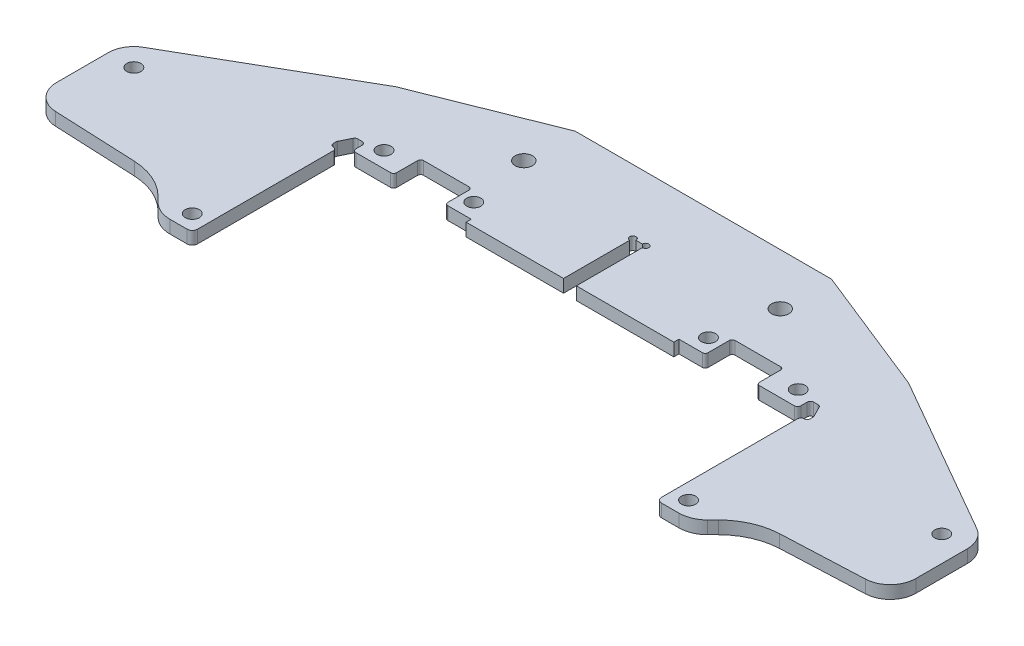
from build123d import *

# Parameters (mm, degrees)
EXTRUDE_1_DEPTH      = 2
CUT_EXTRUDE_1_DEPTH  = 10
SKETCH_3_W           = 2
SKETCH_3_H           = 10
CUT_EXTRUDE_2_DEPTH  = 10
CUT_EXTRUDE_3_DEPTH  = 10
SKETCH_5_W           = 23
SKETCH_5_H           = 22.484633815
CUT_EXTRUDE_4_DEPTH  = 10
SKETCH_6_W           = 32.4
SKETCH_6_H           = 0.8
EXTRUDE_2_DEPTH      = 2
SKETCH_7_R           = 1.1
CUT_EXTRUDE_5_DEPTH  = 10
EXTRUDE_3_DEPTH      = 2
SKETCH_9_R           = 1.1
CUT_EXTRUDE_6_DEPTH  = 10
CHAMFER_2_SIZE       = 5
CHAMFER_2_SIZE_2     = 5.237723549
FILLET_2_R           = 10
FILLET_3_R           = 4.5
SKETCH_10_W          = 1.5
SKETCH_10_H          = 2
CUT_EXTRUDE_7_DEPTH  = 10
SKETCH_11_R          = 1.35
CUT_EXTRUDE_8_DEPTH  = 10
SKETCH_12_W          = 8
SKETCH_12_H          = 4.2
CUT_EXTRUDE_9_DEPTH  = 10
FILLET_5_R           = 0.45
CUT_EXTRUDE_10_DEPTH = 10
FILLET_6_R           = 0.5
FILLET_7_R           = 0.8
SKETCH_14_R          = 0.5
CUT_EXTRUDE_11_DEPTH = 10
SKETCH_15_W          = 2
SKETCH_15_H          = 0.8
CUT_EXTRUDE_12_DEPTH = 10
EXTRUDE_4_DEPTH      = 2
FILLET_8_R           = 4
SKETCH_17_R          = 1.1
CUT_EXTRUDE_13_DEPTH = 10


# Some blends are built 0.0001 mm under size
with BuildPart() as part:
    # 草图1 → 凸台-拉伸1 (new body)
    with BuildSketch(Plane(origin=(0, 0, 0), x_dir=(1, 0, 0), z_dir=(0, 1, 0))):
        Polygon((-20, 0), (20, 0), (60, -20), (60, -40), (0, -40), (-60, -40), (-60, -20), align=None)
    extrude(amount=EXTRUDE_1_DEPTH)

    # 草图2 → 切除-拉伸1 (cut)
    with BuildSketch(Plane(origin=(0, 2, 0), x_dir=(1, 0, 0), z_dir=(0, 1, 0))):
        Polygon((0, -20), (13.2, -20), (13.2, -40), (-13.2, -40), (-13.2, -20), align=None)
    extrude(amount=-CUT_EXTRUDE_1_DEPTH, mode=Mode.SUBTRACT)

    # 草图3 → 切除-拉伸2 (cut)
    with BuildSketch(Plane(origin=(0, 2, 0), x_dir=(1, 0, 0), z_dir=(0, 1, 0))):
        with Locations((0, -15)):
            Rectangle(SKETCH_3_W, SKETCH_3_H)
    extrude(amount=-CUT_EXTRUDE_2_DEPTH, mode=Mode.SUBTRACT)

    # 草图4 → 切除-拉伸3 (cut)
    with BuildSketch(Plane(origin=(0, 2, 0), x_dir=(1, 0, 0), z_dir=(0, 1, 0))):
        Polygon((-60, -40), (-60, -38), (-15, -40), align=None)
        Polygon((60, -40), (15, -40), (60, -38), align=None)
    extrude(amount=-CUT_EXTRUDE_3_DEPTH, mode=Mode.SUBTRACT)

    # 草图5 → 切除-拉伸4 (cut)
    with BuildSketch(Plane(origin=(0, 2, 0), x_dir=(1, 0, 0), z_dir=(0, 1, 0))):
        with Locations((24.7, -31.242316908)):
            Rectangle(SKETCH_5_W, SKETCH_5_H)
        with Locations((-24.7, -31.242316908)):
            Rectangle(SKETCH_5_W, SKETCH_5_H)
    extrude(amount=-CUT_EXTRUDE_4_DEPTH, mode=Mode.SUBTRACT)

    # 草图6 → 凸台-拉伸2 (add)
    with BuildSketch(Plane(origin=(0, 2, 0), x_dir=(1, 0, 0), z_dir=(0, 1, 0))):
        with Locations((0, -20.4)):
            Rectangle(SKETCH_6_W, SKETCH_6_H)
    extrude(amount=-EXTRUDE_2_DEPTH)

    # 草图7 → 切除-拉伸5 (cut)
    with BuildSketch(Plane(origin=(0, 2, 0), x_dir=(1, 0, 0), z_dir=(0, 1, 0))):
        with Locations(Location((32.3, -17.5, 0), (0, 0, 270))):
            Circle(SKETCH_7_R)
        with Locations(Location((18.3, -17.5, 0), (0, 0, 270))):
            Circle(SKETCH_7_R)
        with Locations(Location((-18.3, -17.5, 0), (0, 0, 90))):
            Circle(SKETCH_7_R)
        with Locations(Location((-32.3, -17.5, 0), (0, 0, 90))):
            Circle(SKETCH_7_R)
    extrude(amount=-CUT_EXTRUDE_5_DEPTH, mode=Mode.SUBTRACT)

    # 草图8 → 凸台-拉伸3 (add)
    with BuildSketch(Plane(origin=(0, 2, 0), x_dir=(1, 0, 0), z_dir=(0, 1, 0))):
        Polygon((-36.2, -43.5), (-36.2, -40), (-36.2, -35.5), (-41.2, -35.5), (-41.2, -43.5), align=None)
        Polygon((36.2, -40), (36.2, -35.5), (41.2, -35.5), (41.2, -43.5), (36.2, -43.5), align=None)
    extrude(amount=-EXTRUDE_3_DEPTH)

    # 草图9 → 切除-拉伸6 (cut)
    with BuildSketch(Plane(origin=(0, 2, 0), x_dir=(1, 0, 0), z_dir=(0, 1, 0))):
        with Locations(Location((38.7, -41, 0), (0, 0, 270))):
            Circle(SKETCH_9_R)
        with Locations(Location((-38.7, -41, 0), (0, 0, 90))):
            Circle(SKETCH_9_R)
    extrude(amount=-CUT_EXTRUDE_6_DEPTH, mode=Mode.SUBTRACT)

    # 倒角2
    # the kernel refuses this chamfer: 5.237723549, 5 mm, written as the material it adds along each edge
    with BuildSketch(Plane(origin=(-41.2, 2, 38.835555556), x_dir=(0.02876451379188079, 0, 0.9995862157644616), z_dir=(0, -1, 0))) as chamfer_2_piece_1_section:
        Polygon((CHAMFER_2_SIZE * 0.999586215764, CHAMFER_2_SIZE * 0.0287645137919), (-CHAMFER_2_SIZE_2 * 0.073118387756, CHAMFER_2_SIZE_2 * 0.997323268169), (0, 0), align=None)
    chamfer_2_piece_1 = extrude(amount=2, mode=Mode.PRIVATE)
    chamfer_2_piece_1 = split(chamfer_2_piece_1, bisect_by=Plane(origin=(-42.946846358, 1, 43.5), z_dir=(0, 0, -1)), keep=Keep.TOP, mode=Mode.PRIVATE)
    add(chamfer_2_piece_1)
    with BuildSketch(Plane(origin=(41.2, 2, 38.835555556), x_dir=(-0.028764513791882163, 0, 0.9995862157644615), z_dir=(0, -1, 0))) as chamfer_2_piece_2_section:
        Polygon((CHAMFER_2_SIZE * 0.999586215764, -CHAMFER_2_SIZE * 0.0287645137919), (-CHAMFER_2_SIZE_2 * 0.073118387756, -CHAMFER_2_SIZE_2 * 0.997323268169), (0, 0), align=None)
    chamfer_2_piece_2 = extrude(amount=2, mode=Mode.PRIVATE)
    chamfer_2_piece_2 = split(chamfer_2_piece_2, bisect_by=Plane(origin=(42.946846358, 1, 43.5), z_dir=(0, 0, -1)), keep=Keep.TOP, mode=Mode.PRIVATE)
    add(chamfer_2_piece_2)

    # 圆角2
    fillet_2_edges = [part.edges().sort_by_distance(p)[0] for p in [
        (-46.43255814, 1, 38.602997416),
        (46.43255814, 1, 38.602997416),
    ]]
    fillet(fillet_2_edges, radius=FILLET_2_R)

    # 圆角3
    fillet_3_edges = [part.edges().sort_by_distance(p)[0] for p in [
        (-41.535555556, 1, 43.5),
        (41.535555556, 1, 43.5),
    ]]
    fillet(fillet_3_edges, radius=FILLET_3_R)

    # 草图10 → 切除-拉伸7 (cut)
    with BuildSketch(Plane(origin=(0, 2, 0), x_dir=(1, 0, 0), z_dir=(0, 1, 0))):
        with Locations((35.45, -19)):
            Rectangle(SKETCH_10_W, SKETCH_10_H)
        with Locations((-35.45, -19)):
            Rectangle(SKETCH_10_W, SKETCH_10_H)
    extrude(amount=-CUT_EXTRUDE_7_DEPTH, mode=Mode.SUBTRACT)

    # 草图11 → 切除-拉伸8 (cut)
    with BuildSketch(Plane(origin=(0, 2, 0), x_dir=(1, 0, 0), z_dir=(0, 1, 0))):
        with Locations(Location((20, -8, 0), (0, 0, 270))):
            Circle(SKETCH_11_R)
        with Locations(Location((-20, -8, 0), (0, 0, 270))):
            Circle(SKETCH_11_R)
    extrude(amount=-CUT_EXTRUDE_8_DEPTH, mode=Mode.SUBTRACT)

    # 草图12 → 切除-拉伸9 (cut)
    with BuildSketch(Plane(origin=(0, 2, 0), x_dir=(1, 0, 0), z_dir=(0, 1, 0))):
        with Locations((-24.3, -17.9)):
            Rectangle(SKETCH_12_W, SKETCH_12_H)
        with Locations((24.3, -17.9)):
            Rectangle(SKETCH_12_W, SKETCH_12_H)
    extrude(amount=-CUT_EXTRUDE_9_DEPTH, mode=Mode.SUBTRACT)

    # 圆角5
    fillet_5_edges = [part.edges().sort_by_distance(p)[0] for p in [
        (20.3, 1, 20),
        (28.3, 1, 20),
        (-20.3, 1, 20),
        (-28.3, 1, 20),
        (-28.3, 1, 15.8),
        (-20.3, 1, 15.8),
        (28.3, 1, 15.8),
        (20.3, 1, 15.8),
    ]]
    fillet(fillet_5_edges, radius=FILLET_5_R)

    # 草图13 → 切除-拉伸10 (cut)
    with BuildSketch(Plane(origin=(0, 2, 0), x_dir=(1, 0, 0), z_dir=(0, 1, 0))):
        Polygon((-36.2, -18), (-36.2, -20), (-36.2, -21), (-37.2, -21), (-37.2, -20), align=None)
        Polygon((36.2, -21), (36.2, -20), (36.2, -18), (37.2, -20), (37.2, -21), align=None)
    extrude(amount=-CUT_EXTRUDE_10_DEPTH, mode=Mode.SUBTRACT)

    # 圆角6
    fillet_6_edges = [part.edges().sort_by_distance(p)[0] for p in [
        (34.7, 1, 20),
        (34.7, 1, 18),
        (36.2, 1, 18),
        (-34.7, 1, 18),
        (-34.7, 1, 20),
        (-36.2, 1, 18),
        (-37.2, 1, 20),
        (-36.2, 1, 21),
        (-37.2, 1, 21),
        (37.2, 1, 21),
        (36.2, 1, 21),
        (37.2, 1, 20),
    ]]
    fillet(fillet_6_edges, radius=FILLET_6_R - 0.0001)  # a hair under: the kernel refuses the full size

    # 圆角7
    fillet_7_edges = [part.edges().sort_by_distance(p)[0] for p in [
        (36.2, 1, 43.5),
        (-36.2, 1, 43.5),
    ]]
    fillet(fillet_7_edges, radius=FILLET_7_R)

    # 草图14 → 切除-拉伸11 (cut)
    with BuildSketch(Plane(origin=(0, 2, 0), x_dir=(1, 0, 0), z_dir=(0, 1, 0))):
        with Locations((-1, -10)):
            Circle(SKETCH_14_R)
        with Locations((1, -10)):
            Circle(SKETCH_14_R)
    extrude(amount=-CUT_EXTRUDE_11_DEPTH, mode=Mode.SUBTRACT)

    # 草图15 → 切除-拉伸12 (cut)
    with BuildSketch(Plane(origin=(0, 2, 0), x_dir=(1, 0, 0), z_dir=(0, 1, 0))):
        with Locations((0, -20.4)):
            Rectangle(SKETCH_15_W, SKETCH_15_H)
    extrude(amount=-CUT_EXTRUDE_12_DEPTH, mode=Mode.SUBTRACT)

    # 草图16 → 凸台-拉伸4 (add)
    with BuildSketch(Plane(origin=(0, 2, 0), x_dir=(1, 0, 0), z_dir=(0, 1, 0))):
        Polygon((-60, -20), (-60, -38), (-67, -37.688888889), (-67, -23.5), (-40, -8), (-20, 0), align=None)
        Polygon((40, -8), (67, -23.5), (67, -37.688888889), (60, -38), (60, -20), (20, 0), align=None)
    extrude(amount=-EXTRUDE_4_DEPTH)

    # 圆角8
    fillet_8_edges = [part.edges().sort_by_distance(p)[0] for p in [
        (-67, 1, 37.688888889),
        (-67, 1, 23.5),
        (67, 1, 23.5),
        (67, 1, 37.688888889),
    ]]
    fillet(fillet_8_edges, radius=FILLET_8_R)

    # 草图17 → 切除-拉伸13 (cut)
    with BuildSketch(Plane(origin=(0, 2, 0), x_dir=(1, 0, 0), z_dir=(0, 1, 0))):
        with Locations(Location((-63, -25.81596743, 0), (0, 0, 270))):
            Circle(SKETCH_17_R)
        with Locations(Location((63, -25.81596743, 0), (0, 0, 270))):
            Circle(SKETCH_17_R)
    extrude(amount=-CUT_EXTRUDE_13_DEPTH, mode=Mode.SUBTRACT)


solid = part.part
